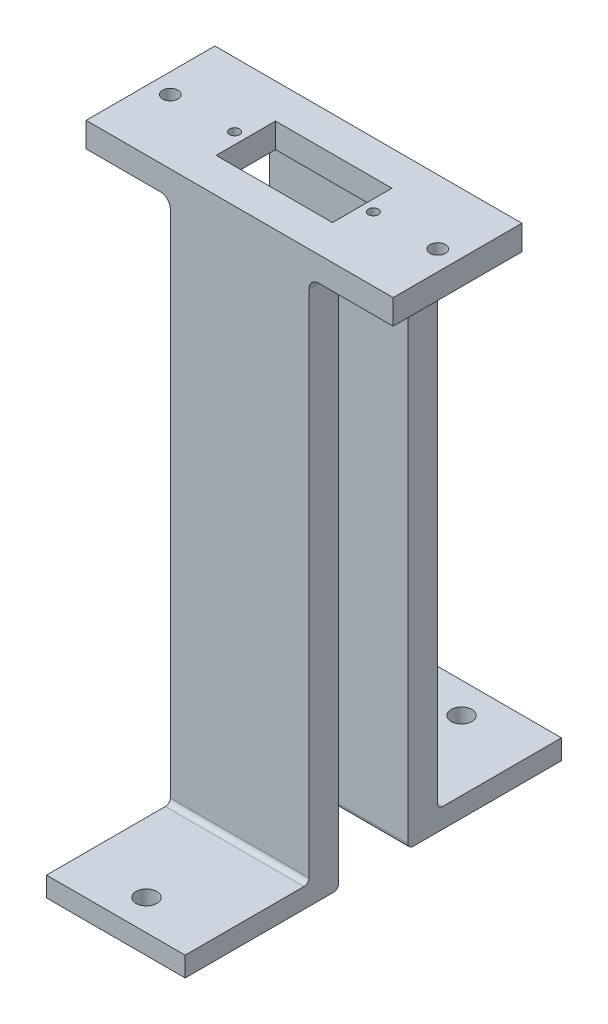
from build123d import *

# Parameters (mm, degrees)
SKETCH_1_W               = 36
SKETCH_1_H               = 30
EXTRUDE_1_DEPTH          = 5
SKETCH_11_W              = 36
SKETCH_11_H              = 8
EXTRUDE_3_DEPTH          = 110
SKETCH_12_W              = 36
SKETCH_12_H              = 8
EXTRUDE_4_DEPTH          = 4
SKETCH_17_W              = 36
SKETCH_17_H              = 5
EXTRUDE_5_DEPTH          = 8
SKETCH_18_W              = 36
SKETCH_18_H              = 5
EXTRUDE_6_DEPTH          = 8
SKETCH_20_W              = 36
SKETCH_20_H              = 4
EXTRUDE_7_DEPTH          = 15
SKETCH_21_W              = 36
SKETCH_21_H              = 4
EXTRUDE_8_DEPTH          = 15
CUT_EXTRUDE_8_REACH      = 124.446
SKETCH_22_R              = 2.1
CUT_EXTRUDE_9_REACH      = 124.446
SKETCH_23_R              = 1.55
CUT_EXTRUDE_10_REACH     = 119.762
SKETCH_26_R              = 1
SKETCH_26_W              = 23.5
SKETCH_26_H              = 12
CUT_EXTRUDE_11_DEPTH     = 2
CUT_EXTRUDE_12_DEPTH     = 2
CUT_EXTRUDE_13_DEPTH     = 2
CUT_EXTRUDE_14_DEPTH     = 2
SKETCH_32_W              = 28
SKETCH_32_H              = 106
CUT_EXTRUDE_15_DEPTH     = 2
SKETCH_33_W              = 28
SKETCH_33_H              = 106
CUT_EXTRUDE_16_DEPTH     = 2
FILLET_2_R               = 1
EXTRUDE_START            = 2
SKETCH_34_W              = 32
SKETCH_34_H              = 14.000594261
SKETCH_34_R              = 1
SKETCH_34_W_2            = 23.5
SKETCH_34_H_2            = 12
EXTRUDE_12_DEPTH         = 2
CUT_EXTRUDE_START        = -2
CUT_EXTRUDE_17_OUTLINE_R = 1
CUT_EXTRUDE_17_OUTLINE_W = 23.5
CUT_EXTRUDE_17_OUTLINE_H = 12
CUT_EXTRUDE_17_DEPTH     = 2
SKETCH_36_W              = 46
SKETCH_36_H              = 5
EXTRUDE_13_DEPTH         = 15
SKETCH_37_W              = 46
SKETCH_37_H              = 5
EXTRUDE_14_DEPTH         = 15
SKETCH_38_R              = 1.55
CUT_EXTRUDE_18_DEPTH     = 5
CUT_EXTRUDE_19_REACH     = 122.437
SKETCH_39_W              = 62
SKETCH_39_H              = 10
FILLET_3_R               = 2


# Read off the part's stored shape, not the designer's step: 切除-拉伸17
with BuildPart() as part:
    # 草图1 → 凸台-拉伸1 (new body)
    with BuildSketch(Plane(origin=(0, 0, 0), x_dir=(1, 0, 0), z_dir=(0, 1, 0))):
        Rectangle(SKETCH_1_W, SKETCH_1_H)
    extrude(amount=EXTRUDE_1_DEPTH)

    # 草图11 → 凸台-拉伸3 (add)
    with BuildSketch(Plane.XZ):
        with Locations((0, 11)):
            Rectangle(SKETCH_11_W, SKETCH_11_H)
        with Locations((0, -11)):
            Rectangle(SKETCH_11_W, SKETCH_11_H)
    extrude(amount=EXTRUDE_3_DEPTH)

    # 草图12 → 凸台-拉伸4 (add)
    with BuildSketch(Plane.XZ.offset(110)):
        with Locations((0, 19)):
            Rectangle(SKETCH_12_W, SKETCH_12_H)
        with Locations((0, -19)):
            Rectangle(SKETCH_12_W, SKETCH_12_H)
    extrude(amount=-EXTRUDE_4_DEPTH)

    # 草图17 → 凸台-拉伸5 (add)
    with BuildSketch(Plane(origin=(0, 0, -15), x_dir=(-1, 0, 0), z_dir=(0, 0, -1))):
        with Locations((0, 2.5)):
            Rectangle(SKETCH_17_W, SKETCH_17_H)
    extrude(amount=EXTRUDE_5_DEPTH)

    # 草图18 → 凸台-拉伸6 (add)
    with BuildSketch(Plane.XY.offset(15)):
        with Locations((0, 2.5)):
            Rectangle(SKETCH_18_W, SKETCH_18_H)
    extrude(amount=EXTRUDE_6_DEPTH)

    # 草图20 → 凸台-拉伸7 (add)
    with BuildSketch(Plane.XY.offset(23)):
        with Locations((0, -108)):
            Rectangle(SKETCH_20_W, SKETCH_20_H)
    extrude(amount=EXTRUDE_7_DEPTH)

    # 草图21 → 凸台-拉伸8 (add)
    with BuildSketch(Plane(origin=(0, 0, -23), x_dir=(-1, 0, 0), z_dir=(0, 0, -1))):
        with Locations((0, -108)):
            Rectangle(SKETCH_21_W, SKETCH_21_H)
    extrude(amount=EXTRUDE_8_DEPTH)

    # 草图22 → 切除-拉伸8 (cut, up to next)
    with BuildSketch(Plane.XZ.offset(110), mode=Mode.PRIVATE) as cut_extrude_8_sk1:
        with Locations(Location((0, 31.819805155, 0), (0, 0, 270))):
            Circle(SKETCH_22_R)
    cut_extrude_8_tool1 = extrude(cut_extrude_8_sk1.sketch, amount=-CUT_EXTRUDE_8_REACH, mode=Mode.PRIVATE) & part.part
    # 草图22 → 切除-拉伸8 (cut, up to next)
    with BuildSketch(Plane.XZ.offset(110), mode=Mode.PRIVATE) as cut_extrude_8_sk2:
        with Locations(Location((0, -31.819805155, 0), (0, 0, 270))):
            Circle(SKETCH_22_R)
    cut_extrude_8_tool2 = extrude(cut_extrude_8_sk2.sketch, amount=-CUT_EXTRUDE_8_REACH, mode=Mode.PRIVATE) & part.part
    add(cut_extrude_8_tool1.solids().sort_by_distance((0, -110, 31.819805))[0], mode=Mode.SUBTRACT)
    add(cut_extrude_8_tool2.solids().sort_by_distance((0, -110, -31.819805))[0], mode=Mode.SUBTRACT)

    # 草图23 → 切除-拉伸9 (cut, up to next)
    with BuildSketch(Plane(origin=(0, 5, 0), x_dir=(1, 0, 0), z_dir=(0, 1, 0)), mode=Mode.PRIVATE) as cut_extrude_9_sk1:
        with Locations(Location((0, 18, 0), (0, 0, 270))):
            Circle(SKETCH_23_R)
    cut_extrude_9_tool1 = extrude(cut_extrude_9_sk1.sketch, amount=-CUT_EXTRUDE_9_REACH, mode=Mode.PRIVATE) & part.part
    # 草图23 → 切除-拉伸9 (cut, up to next)
    with BuildSketch(Plane(origin=(0, 5, 0), x_dir=(1, 0, 0), z_dir=(0, 1, 0)), mode=Mode.PRIVATE) as cut_extrude_9_sk2:
        with Locations(Location((0, -18, 0), (0, 0, 270))):
            Circle(SKETCH_23_R)
    cut_extrude_9_tool2 = extrude(cut_extrude_9_sk2.sketch, amount=-CUT_EXTRUDE_9_REACH, mode=Mode.PRIVATE) & part.part
    add(cut_extrude_9_tool1.solids().sort_by_distance((0, 5, -18))[0], mode=Mode.SUBTRACT)
    add(cut_extrude_9_tool2.solids().sort_by_distance((0, 5, 18))[0], mode=Mode.SUBTRACT)

    # 草图26 → 切除-拉伸10 (cut, up to next)
    with BuildSketch(Plane(origin=(0, 0, 0), x_dir=(-1, 0, 0), z_dir=(0, -1, 0)), mode=Mode.PRIVATE) as cut_extrude_10_sk1:
        with Locations(Location((-14, 0, 0), (0, 0, 90))):
            Circle(SKETCH_26_R)
    cut_extrude_10_tool1 = extrude(cut_extrude_10_sk1.sketch, amount=-CUT_EXTRUDE_10_REACH, mode=Mode.PRIVATE) & part.part
    # 草图26 → 切除-拉伸10 (cut, up to next)
    with BuildSketch(Plane(origin=(0, 0, 0), x_dir=(-1, 0, 0), z_dir=(0, -1, 0)), mode=Mode.PRIVATE) as cut_extrude_10_sk2:
        with Locations(Location((14, 0, 0), (0, 0, 270))):
            Circle(SKETCH_26_R)
    cut_extrude_10_tool2 = extrude(cut_extrude_10_sk2.sketch, amount=-CUT_EXTRUDE_10_REACH, mode=Mode.PRIVATE) & part.part
    # 草图26 → 切除-拉伸10 (cut, up to next)
    with BuildSketch(Plane(origin=(0, 0, 0), x_dir=(-1, 0, 0), z_dir=(0, -1, 0)), mode=Mode.PRIVATE) as cut_extrude_10_sk3:
        Rectangle(SKETCH_26_W, SKETCH_26_H)
    cut_extrude_10_tool3 = extrude(cut_extrude_10_sk3.sketch, amount=-CUT_EXTRUDE_10_REACH, mode=Mode.PRIVATE) & part.part
    add(cut_extrude_10_tool1.solids().sort_by_distance((14, 0, 0))[0], mode=Mode.SUBTRACT)
    add(cut_extrude_10_tool2.solids().sort_by_distance((-14, 0, 0))[0], mode=Mode.SUBTRACT)
    add(cut_extrude_10_tool3.solids().sort_by_distance((0, 0, 0))[0], mode=Mode.SUBTRACT)

    # 草图28 → 切除-拉伸11 (cut)
    with BuildSketch(Plane(origin=(18, 0, 0), x_dir=(0, 0, -1), z_dir=(1, 0, 0))):
        Polygon((23, 5), (-23, 5), (-23, 0), (-15, 0), (-15, -106), (-38, -106), (-38, -110), (-7, -110), (-7, 0), (7, 0), (7, -110), (38, -110), (38, -106), (15, -106), (15, 0), (23, 0), align=None)
    extrude(amount=-CUT_EXTRUDE_11_DEPTH, mode=Mode.SUBTRACT)

    # 草图29 → 切除-拉伸12 (cut)
    with BuildSketch(Plane.ZY.offset(18)):
        Polygon((23, 5), (-23, 5), (-23, 0), (-15, 0), (-15, -106), (-38, -106), (-38, -110), (-7, -110), (-7, 0), (7, 0), (7, -110), (38, -110), (38, -106), (15, -106), (15, 0), (23, 0), align=None)
    extrude(amount=-CUT_EXTRUDE_12_DEPTH, mode=Mode.SUBTRACT)

    # 草图30 → 切除-拉伸13 (cut)
    with BuildSketch(Plane(origin=(16, 0, 0), x_dir=(0, 0, -1), z_dir=(1, 0, 0))):
        Polygon((-15, 0), (-7, 0), (-7, -110), (-38, -110), (-38, -106), (-15, -106), align=None)
        Polygon((7, 0), (15, 0), (15, -106), (38, -106), (38, -110), (7, -110), align=None)
    extrude(amount=-CUT_EXTRUDE_13_DEPTH, mode=Mode.SUBTRACT)

    # 草图31 → 切除-拉伸14 (cut)
    with BuildSketch(Plane.ZY.offset(16)):
        Polygon((-7, 0), (-7, -110), (-38, -110), (-38, -106), (-15, -106), (-15, 0), align=None)
        Polygon((15, 0), (15, -106), (38, -106), (38, -110), (7, -110), (7, 0), align=None)
    extrude(amount=-CUT_EXTRUDE_14_DEPTH, mode=Mode.SUBTRACT)

    # 草图32 → 切除-拉伸15 (cut)
    with BuildSketch(Plane.XY.offset(15)):
        with Locations((0, -53)):
            Rectangle(SKETCH_32_W, SKETCH_32_H)
    extrude(amount=-CUT_EXTRUDE_15_DEPTH, mode=Mode.SUBTRACT)

    # 草图33 → 切除-拉伸16 (cut)
    with BuildSketch(Plane(origin=(0, 0, -15), x_dir=(-1, 0, 0), z_dir=(0, 0, -1))):
        with Locations((0, -53)):
            Rectangle(SKETCH_33_W, SKETCH_33_H)
    extrude(amount=-CUT_EXTRUDE_16_DEPTH, mode=Mode.SUBTRACT)

    # 圆角2
    fillet_2_edges = [part.edges().sort_by_distance(p)[0] for p in [
        (0, -110, -7),
        (0, -110, 7),
        (0, -106, 13),
        (0, -106, -13),
    ]]
    fillet(fillet_2_edges, radius=FILLET_2_R)

    # 草图34 → 凸台-拉伸12 (add)
    with BuildSketch(Plane.XZ.offset(EXTRUDE_START)):
        with Locations((0, 0.000297131)):
            Rectangle(SKETCH_34_W, SKETCH_34_H)
        with Locations(Location((14, 0, 0), (0, 0, 270))):
            Circle(SKETCH_34_R, mode=Mode.SUBTRACT)
        with Locations(Location((-14, 0, 0), (0, 0, 270))):
            Circle(SKETCH_34_R, mode=Mode.SUBTRACT)
        Rectangle(SKETCH_34_W_2, SKETCH_34_H_2, mode=Mode.SUBTRACT)
    extrude(amount=-EXTRUDE_12_DEPTH)

    # 切除-拉伸17 outline → 切除-拉伸17 (cut)
    with BuildSketch(Plane.XZ.offset(2).offset(CUT_EXTRUDE_START)):
        Polygon((-16, -7), (16, -7), (16, 7.000594261), (14, 7.000594261), (14, 7), (-14, 7), (-14, 7.000594261), (-16, 7.000594261), align=None)
        with Locations((-14, 0)):
            Circle(CUT_EXTRUDE_17_OUTLINE_R, mode=Mode.SUBTRACT)
        Rectangle(CUT_EXTRUDE_17_OUTLINE_W, CUT_EXTRUDE_17_OUTLINE_H, mode=Mode.SUBTRACT)
        with Locations((14, 0)):
            Circle(CUT_EXTRUDE_17_OUTLINE_R, mode=Mode.SUBTRACT)
    extrude(amount=CUT_EXTRUDE_17_DEPTH, mode=Mode.SUBTRACT)

    # 草图36 → 凸台-拉伸13 (add)
    with BuildSketch(Plane.ZY.offset(16)):
        with Locations((0, 2.5)):
            Rectangle(SKETCH_36_W, SKETCH_36_H)
    extrude(amount=EXTRUDE_13_DEPTH)

    # 草图37 → 凸台-拉伸14 (add)
    with BuildSketch(Plane(origin=(16, 0, 0), x_dir=(0, 0, -1), z_dir=(1, 0, 0))):
        with Locations((0, 2.5)):
            Rectangle(SKETCH_37_W, SKETCH_37_H)
    extrude(amount=EXTRUDE_14_DEPTH)

    # 草图38 → 切除-拉伸18 (cut)
    with BuildSketch(Plane.XZ):
        with Locations(Location((-27, 0, 0), (0, 0, 270))):
            Circle(SKETCH_38_R)
        with Locations(Location((27, 0, 0), (0, 0, 90))):
            Circle(SKETCH_38_R)
    extrude(amount=-CUT_EXTRUDE_18_DEPTH, mode=Mode.SUBTRACT)

    # 草图39 → 切除-拉伸19 (cut, up to next)
    with BuildSketch(Plane.XZ, mode=Mode.PRIVATE) as cut_extrude_19_sk1:
        with Locations((0, 18)):
            Rectangle(SKETCH_39_W, SKETCH_39_H)
    cut_extrude_19_tool1 = extrude(cut_extrude_19_sk1.sketch, amount=-CUT_EXTRUDE_19_REACH, mode=Mode.PRIVATE) & part.part
    # 草图39 → 切除-拉伸19 (cut, up to next)
    with BuildSketch(Plane.XZ, mode=Mode.PRIVATE) as cut_extrude_19_sk2:
        with Locations((0, -18)):
            Rectangle(SKETCH_39_W, SKETCH_39_H)
    cut_extrude_19_tool2 = extrude(cut_extrude_19_sk2.sketch, amount=-CUT_EXTRUDE_19_REACH, mode=Mode.PRIVATE) & part.part
    add(cut_extrude_19_tool1.solids().sort_by_distance((0, 0, 18))[0], mode=Mode.SUBTRACT)
    add(cut_extrude_19_tool2.solids().sort_by_distance((0, 0, -18))[0], mode=Mode.SUBTRACT)

    # 圆角3
    fillet_3_edges = [part.edges().sort_by_distance(p)[0] for p in [
        (-14, 0, -10),
        (-14, 0, 10),
        (14, 0, -10),
        (14, 0, 10),
    ]]
    fillet(fillet_3_edges, radius=FILLET_3_R)


solid = part.part
